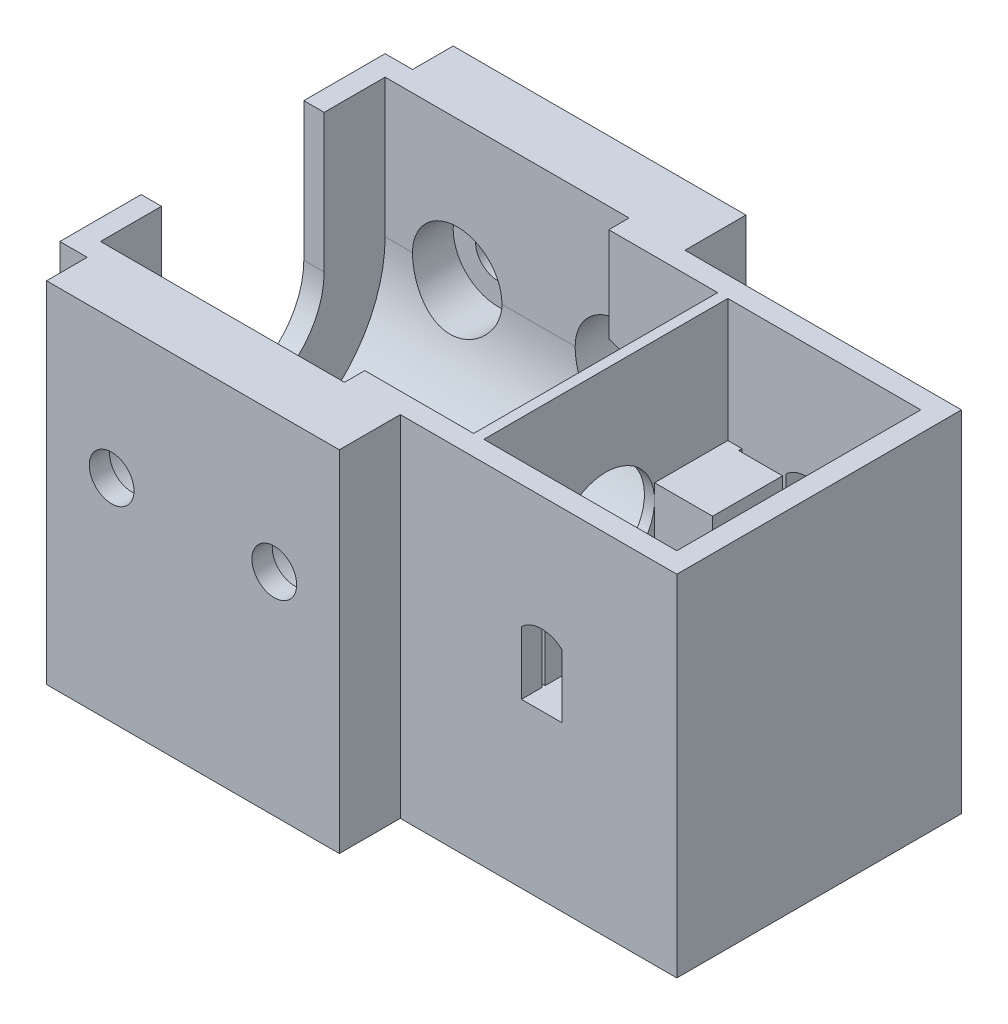
from build123d import *
from build123d.topology import SkipClean

# Parameters (mm, degrees)
SKETCH1_W                       = 116.84
SKETCH1_H                       = 50.8
BOSS_EXTRUDE1_DEPTH             = 31.75
SKETCH38_W                      = 20
SKETCH38_H                      = 20
CUT_EXTRUDE33_DEPTH             = 33.3134
SKETCH37_W                      = 63.5
SKETCH37_H                      = 25.4
CUT_EXTRUDE32_DEPTH             = 132.302277589
BOSS_EXTRUDE5_DEPTH             = 25.4
BOSS_EXTRUDE6_REACH             = 98.929
SKETCH40_W                      = 16.9009
SKETCH40_H                      = 20
SKETCH41_R                      = 3.113413941
CUT_EXTRUDE34_DEPTH             = 97.928543268
CUT_EXTRUDE35_DEPTH             = 97.928543399
CUT_EXTRUDE35_DEPTH_BACK        = 97.928543399
SKETCH42_R                      = 3.4925
SKETCH43_R                      = 6.985
CUT_EXTRUDE36_DEPTH             = 28.575
CUT_EXTRUDE37_START             = 28.575
SKETCH43_2_R                    = 6.985
CUT_EXTRUDE37_DEPTH             = 28.575
SKETCH44_W                      = 15.9125
SKETCH44_H                      = 38.1
CUT_EXTRUDE38_DEPTH             = 35.4
CUT_EXTRUDE39_REACH             = 98.929
SKETCH45_W                      = 14.2259
SKETCH45_H                      = 15.4
CUT_EXTRUDE39_DIRECTION_2_REACH = 98.929
SKETCH46_W                      = 43.18
SKETCH46_H                      = 9.525
SKETCH46_W_2                    = 27.94
SKETCH46_H_2                    = 6.35
CUT_EXTRUDE40_DEPTH             = 97.928543399
SKETCH49_W                      = 23.6641
SKETCH49_H                      = 50.8
CUT_EXTRUDE42_DEPTH             = 97.928543399
SKETCH50_W                      = 0.254
SKETCH50_H                      = 1.524
CUT_EXTRUDE43_DEPTH             = 2.54
SKETCH52_R                      = 0.3175
CUT_EXTRUDE45_DEPTH             = 0.0508
SKETCH53_R                      = 2
CUT_EXTRUDE46_DEPTH             = 0.0254
BOSS_EXTRUDE7_DEPTH             = 2.54
SKETCH55_W                      = 15.9125
SKETCH55_H                      = 9.05
BOSS_EXTRUDE8_DEPTH             = 17.46
CUT_EXTRUDE47_DEPTH             = 7.62
SKETCH58_R                      = 3.113413941
BOSS_EXTRUDE10_DEPTH            = 7.62
SKETCH59_W                      = 0.5
SKETCH59_H                      = 20
CUT_EXTRUDE48_DEPTH             = 7.62
CUT_EXTRUDE44_DEPTH             = 0.635
SKETCH60_W                      = 121.35651469
SKETCH60_H                      = 81.059088534
CUT_EXTRUDE49_DEPTH             = 10.16
SKETCH61_R                      = 8.976217823
SKETCH61_R_2                    = 7.62
BOSS_EXTRUDE11_DEPTH            = 1.5875
BOSS_EXTRUDE12_REACH            = 80.084
SKETCH62_W                      = 1.5875
SKETCH62_H                      = 15.24
SKETCH64_W                      = 30.1384
SKETCH64_H                      = 38.1
BOSS_EXTRUDE14_DEPTH            = 6.35
BOSS_EXTRUDE16_REACH            = 91.468
SKETCH65_W                      = 2.38
SKETCH65_H                      = 9.84
SKETCH66_W                      = 0.5
SKETCH66_H                      = 20
CUT_EXTRUDE50_DEPTH             = 20
CUT_EXTRUDE51_DEPTH             = 9.84
CUT_EXTRUDE53_DEPTH             = 94.560446711


with BuildPart() as part:
    # Sketch1 → Boss-Extrude1 (new, symmetric)
    with BuildSketch(Plane.XY):
        with Locations((-17.78, -25.4)):
            Rectangle(SKETCH1_W, SKETCH1_H)
    extrude(amount=BOSS_EXTRUDE1_DEPTH, both=True)

    # Sketch2 → Cut-Revolve1 (revolve, cut)
    with BuildSketch(Plane.XY, mode=Mode.PRIVATE) as cut_revolve1_sk:
        Polygon((-49.3609, -3.175), (-49.3609, -12.7), (-220.202391615, -12.7), (-220.202391615, -25.4), (-157.809194346, -25.4), (-128.417210056, -25.4), (6.8382, -25.4), (40.64, -25.4), (40.64, -17.78), (23.7391, -17.78), (5.7391, -17.78), (5.7391, -6.35), (-11.2609, -6.35), (-11.2609, -3.175), align=None)
    revolve(cut_revolve1_sk.sketch.rotate(Axis((-152.482877195, -25.4, 0), (1, 0, 0)), 180), axis=Axis((-152.482877195, -25.4, 0), (1, 0, 0)), mode=Mode.SUBTRACT)

    # Sketch38 → Cut-Extrude33 (cut)
    with BuildSketch(Plane(origin=(40.64, 0, 0), x_dir=(0, 0, -1), z_dir=(1, 0, 0))):
        with Locations((0, -25.4)):
            Rectangle(SKETCH38_W, SKETCH38_H)
    extrude(amount=-CUT_EXTRUDE33_DEPTH, mode=Mode.SUBTRACT)

    # Sketch37 → Cut-Extrude32 (cut, through all)
    with BuildSketch(Plane(origin=(40.64, 0, 0), x_dir=(0, 0, -1), z_dir=(1, 0, 0))):
        with Locations((0, -12.7)):
            Rectangle(SKETCH37_W, SKETCH37_H)
    extrude(amount=-CUT_EXTRUDE32_DEPTH, mode=Mode.SUBTRACT)

    # Sketch39 → Boss-Extrude5 (add)
    with BuildSketch(Plane(origin=(0, -25.4, 0), x_dir=(1, 0, 0), z_dir=(0, 1, 0))):
        Polygon((5.7391, 19.05), (5.7391, 7.62), (7.3266, 7.62), (7.3266, 10), (40.64, 10), (40.64, 31.75), (-76.2, 31.75), (-76.2, 12.7), (-49.3609, 12.7), (-49.3609, 22.225), (-11.2609, 22.225), (-11.2609, 19.05), align=None)
        Polygon((40.64, -10), (7.3266, -10), (7.3266, -7.62), (5.7391, -7.62), (5.7391, -19.05), (-11.2609, -19.05), (-11.2609, -22.225), (-49.3609, -22.225), (-49.3609, -12.7), (-76.2, -12.7), (-76.2, -31.75), (40.64, -31.75), align=None)
    extrude(amount=BOSS_EXTRUDE5_DEPTH)

    # Sketch40 → Boss-Extrude6 (add, up to next)
    with BuildSketch(Plane(origin=(0, 0, 0), x_dir=(1, 0, 0), z_dir=(0, 1, 0)), mode=Mode.PRIVATE) as boss_extrude6_sk1:
        with Locations((32.18955, 0)):
            Rectangle(SKETCH40_W, SKETCH40_H)
    boss_extrude6_tool1 = extrude(boss_extrude6_sk1.sketch, amount=-BOSS_EXTRUDE6_REACH, mode=Mode.PRIVATE) - part.part
    add(boss_extrude6_tool1.solids().sort_by_distance((32.18955, 0, 0))[0])

    # Sketch41 → Cut-Extrude34 (cut, through all)
    with BuildSketch(Plane(origin=(0, 0, 0), x_dir=(1, 0, 0), z_dir=(0, 1, 0))):
        with Locations(Location((-57.15, 0, 0), (0, 0, 270))):
            Circle(SKETCH41_R)
        with Locations(Location((-31.75, 0, 0), (0, 0, 270))):
            Circle(SKETCH41_R)
        with Locations(Location((-6.35, 0, 0), (0, 0, 270))):
            Circle(SKETCH41_R)
    extrude(amount=-CUT_EXTRUDE34_DEPTH, mode=Mode.SUBTRACT)

    # Sketch42 → Cut-Extrude35 (cut, two sides: drawn at the far end of the back side and taken through both)
    with BuildSketch(Plane.XY.offset(-CUT_EXTRUDE35_DEPTH_BACK)):
        with Locations((-38.1, -25.4)):
            Circle(SKETCH42_R)
        with Locations((-12.7, -25.4)):
            Circle(SKETCH42_R)
    extrude(amount=CUT_EXTRUDE35_DEPTH + CUT_EXTRUDE35_DEPTH_BACK, mode=Mode.SUBTRACT)

    # Sketch43 → Cut-Extrude36 (cut)
    with BuildSketch(Plane.XY):
        with Locations(Location((-38.1, -25.4, 0), (0, 0, 180))):
            Circle(SKETCH43_R)
        with Locations(Location((-12.7, -25.4, 0), (0, 0, 180))):
            Circle(SKETCH43_R)
    extrude(amount=-CUT_EXTRUDE36_DEPTH, mode=Mode.SUBTRACT)

    # Sketch43<2> → Cut-Extrude37 (cut)
    with BuildSketch(Plane.XY.offset(CUT_EXTRUDE37_START)):
        with Locations(Location((-38.1, -25.4, 0), (0, 0, 180))):
            Circle(SKETCH43_2_R)
        with Locations(Location((-12.7, -25.4, 0), (0, 0, 180))):
            Circle(SKETCH43_2_R)
    extrude(amount=-CUT_EXTRUDE37_DEPTH, mode=Mode.SUBTRACT)

    # Sketch44 → Cut-Extrude38 (cut)
    with BuildSketch(Plane(origin=(0, 0, 0), x_dir=(1, 0, 0), z_dir=(0, 1, 0))):
        with Locations((15.28285, 0)):
            Rectangle(SKETCH44_W, SKETCH44_H)
    extrude(amount=-CUT_EXTRUDE38_DEPTH, mode=Mode.SUBTRACT)

    # Cut-Extrude39: up to this face of the body (flat: up to its plane)
    cut_extrude39_end = Plane(part.part.faces().sort_by_distance((15.28285, -17.7, -19.05))[0])
    # Sketch45 → Cut-Extrude39 (cut, up to the picked face)
    with BuildSketch(Plane.XY, mode=Mode.PRIVATE) as cut_extrude39_sk1:
        with Locations((30.35205, -7.7)):
            Rectangle(SKETCH45_W, SKETCH45_H)
    cut_extrude39_tool1 = split(extrude(cut_extrude39_sk1.sketch, amount=-CUT_EXTRUDE39_REACH, mode=Mode.PRIVATE), bisect_by=cut_extrude39_end, keep=Keep.BOTH, mode=Mode.PRIVATE)
    add(cut_extrude39_tool1.solids().sort_by(Axis((30.35205, -7.7, 0), (0, 0, -1)))[0], mode=Mode.SUBTRACT)

    # Cut-Extrude39 direction 2: up to this face of the body (flat: up to its plane)
    cut_extrude39_direction_2_end = Plane(part.part.faces().sort_by_distance((15.28285, -17.7, 19.05))[0])
    # Sketch45 → Cut-Extrude39 direction 2 (cut, up to the picked face)
    with BuildSketch(Plane.XY, mode=Mode.PRIVATE) as cut_extrude39_direction_2_sk1:
        with Locations((30.35205, -7.7)):
            Rectangle(SKETCH45_W, SKETCH45_H)
    cut_extrude39_direction_2_tool1 = split(extrude(cut_extrude39_direction_2_sk1.sketch, amount=CUT_EXTRUDE39_DIRECTION_2_REACH, mode=Mode.PRIVATE), bisect_by=cut_extrude39_direction_2_end, keep=Keep.BOTH, mode=Mode.PRIVATE)
    add(cut_extrude39_direction_2_tool1.solids().sort_by(Axis((30.35205, -7.7, 0), (0, 0, 1)))[0], mode=Mode.SUBTRACT)

    # Sketch46 → Cut-Extrude40 (cut, through all)
    with BuildSketch(Plane(origin=(0, 0, 0), x_dir=(1, 0, 0), z_dir=(0, 1, 0))):
        with Locations((19.05, 26.9875)):
            Rectangle(SKETCH46_W, SKETCH46_H)
        with Locations((19.05, -26.9875)):
            Rectangle(SKETCH46_W, SKETCH46_H)
        with Locations((-62.23, 28.575)):
            Rectangle(SKETCH46_W_2, SKETCH46_H_2)
        with Locations((-62.23, -28.575)):
            Rectangle(SKETCH46_W_2, SKETCH46_H_2)
    extrude(amount=-CUT_EXTRUDE40_DEPTH, mode=Mode.SUBTRACT)

    # Sketch49 → Cut-Extrude42 (cut, through all)
    with BuildSketch(Plane(origin=(0, 0, 0), x_dir=(1, 0, 0), z_dir=(0, 1, 0))):
        with Locations((-64.36795, 0)):
            Rectangle(SKETCH49_W, SKETCH49_H)
    extrude(amount=-CUT_EXTRUDE42_DEPTH, mode=Mode.SUBTRACT)

    # Sketch50 → Cut-Extrude43 (cut)
    with BuildSketch(Plane(origin=(0, 0, 0), x_dir=(1, 0, 0), z_dir=(0, 1, 0))):
        with Locations((23.1121, 21.463)):
            Rectangle(SKETCH50_W, SKETCH50_H)
        with Locations((21.5881, 21.463)):
            Rectangle(SKETCH50_W, SKETCH50_H)
        with Locations((20.0641, 21.463)):
            Rectangle(SKETCH50_W, SKETCH50_H)
        with Locations((18.5401, 21.463)):
            Rectangle(SKETCH50_W, SKETCH50_H)
        with Locations((17.0161, 21.463)):
            Rectangle(SKETCH50_W, SKETCH50_H)
        with Locations((15.4921, 21.463)):
            Rectangle(SKETCH50_W, SKETCH50_H)
        with Locations((13.9681, 21.463)):
            Rectangle(SKETCH50_W, SKETCH50_H)
        with Locations((12.4441, 21.463)):
            Rectangle(SKETCH50_W, SKETCH50_H)
        with Locations((10.9201, 21.463)):
            Rectangle(SKETCH50_W, SKETCH50_H)
        with Locations((9.3961, 21.463)):
            Rectangle(SKETCH50_W, SKETCH50_H)
    extrude(amount=-CUT_EXTRUDE43_DEPTH, mode=Mode.SUBTRACT)

    # Sketch52 → Cut-Extrude45 (cut)
    with BuildSketch(Plane.ZY.offset(-23.7391)):
        with Locations(Location((0, -25.4, 0), (0, 0, 270))):
            Circle(SKETCH52_R)
    extrude(amount=-CUT_EXTRUDE45_DEPTH, mode=Mode.SUBTRACT)

    # Sketch53 → Cut-Extrude46 (cut)
    with BuildSketch(Plane.ZY.offset(-23.7391)):
        with Locations(Location((0, -25.4, 0), (0, 0, 270))):
            Circle(SKETCH53_R)
    extrude(amount=-CUT_EXTRUDE46_DEPTH, mode=Mode.SUBTRACT)

    # Sketch54 → Boss-Extrude7 (add)
    with BuildSketch(Plane(origin=(0, -35.4, 0), x_dir=(1, 0, 0), z_dir=(0, 1, 0))):
        Polygon((23.2391, 10), (23.2391, -10), (23.2391, -19.05), (7.3266, -19.05), (7.3266, 19.05), (23.2391, 19.05), align=None)
    extrude(amount=BOSS_EXTRUDE7_DEPTH)

    # Sketch55 → Boss-Extrude8 (add)
    with BuildSketch(Plane(origin=(0, -32.86, 0), x_dir=(1, 0, 0), z_dir=(0, 1, 0))):
        with Locations((15.28285, 14.525)):
            Rectangle(SKETCH55_W, SKETCH55_H)
        with Locations((15.28285, -14.525)):
            Rectangle(SKETCH55_W, SKETCH55_H)
    extrude(amount=BOSS_EXTRUDE8_DEPTH)

    # Sketch57 → Cut-Extrude47 (cut)
    with BuildSketch(Plane(origin=(0, -15.4, 0), x_dir=(1, 0, 0), z_dir=(0, 1, 0))):
        Polygon((23.7391, -10), (7.3266, -10), (7.3266, -19.05), (37.465, -19.05), (37.465, 19.05), (7.3266, 19.05), (7.3266, 10), (23.7391, 10), align=None)
    extrude(amount=-CUT_EXTRUDE47_DEPTH, mode=Mode.SUBTRACT)

    # Sketch58 → Boss-Extrude10 (add)
    with SkipClean():  # the faces are left unmerged after this step: merging them gives an invalid solid
        with BuildSketch(Plane.XZ.offset(50.8)):
            Polygon((-48.26, 25.4), (-52.5359, 25.4), (-52.5359, -25.4), (-48.26, -25.4), (-48.26, -31.75), (-2.54, -31.75), (-2.54, -22.225), (40.64, -22.225), (40.64, 22.225), (-2.54, 22.225), (-2.54, 31.75), (-48.26, 31.75), align=None)
            with Locations((-31.75, 0)):
                Circle(SKETCH58_R, mode=Mode.SUBTRACT)
            with Locations(Location((-6.35, 0, 0), (0, 0, 90))):
                Circle(SKETCH58_R, mode=Mode.SUBTRACT)
        extrude(amount=BOSS_EXTRUDE10_DEPTH)

    # Sketch59 → Cut-Extrude48 (cut)
    with SkipClean():  # the faces are left unmerged after this step: merging them gives an invalid solid
        with BuildSketch(Plane(origin=(0, -35.4, 0), x_dir=(1, 0, 0), z_dir=(0, 1, 0))):
            with Locations((23.4891, 0)):
                Rectangle(SKETCH59_W, SKETCH59_H)
        extrude(amount=-CUT_EXTRUDE48_DEPTH, mode=Mode.SUBTRACT)

    # Sketch51 → Cut-Extrude44 (cut)
    # profile 1 of 3: a face of its own
    with SkipClean():  # the faces are left unmerged after this step: merging them gives an invalid solid
        with BuildSketch(Plane(origin=(0, -23.02, 0), x_dir=(1, 0, 0), z_dir=(0, 1, 0))):
            Polygon((25.098, 0.254), (26.10821862, 0.254), (26.10821862, 2.54), (26.61621862, 2.54), (26.61621862, 0.254), (27.62643724, 0.254), (27.62643724, 2.54), (28.13443724, 2.54), (28.13443724, 0.254), (29.14465586, 0.254), (29.14465586, 2.54), (29.65265586, 2.54), (29.65265586, 0.254), (30.66287448, 0.254), (30.66287448, 2.54), (31.17087448, 2.54), (31.17087448, 0.254), (32.1810931, 0.254), (32.1810931, 2.54), (32.6890931, 2.54), (32.6890931, 0.254), (33.69931172, 0.254), (33.69931172, 2.54), (34.20731172, 2.54), (34.20731172, 0.254), (35.21753034, 0.254), (35.21753034, 2.54), (35.72553034, 2.54), (35.72553034, 0.254), (37.465, 0.254), (37.465, -0.254), (35.72553034, -0.254), (35.72553034, -2.54), (35.21753034, -2.54), (35.21753034, -0.254), (34.20731172, -0.254), (34.20731172, -2.54), (33.69931172, -2.54), (33.69931172, -0.254), (32.6890931, -0.254), (32.6890931, -2.54), (32.1810931, -2.54), (32.1810931, -0.254), (31.17087448, -0.254), (31.17087448, -2.54), (30.66287448, -2.54), (30.66287448, -0.254), (29.65265586, -0.254), (29.65265586, -2.54), (29.14465586, -2.54), (29.14465586, -0.254), (28.13443724, -0.254), (28.13443724, -2.54), (27.62643724, -2.54), (27.62643724, -0.254), (26.61621862, -0.254), (26.61621862, -2.54), (26.10821862, -2.54), (26.10821862, -0.254), (25.098, -0.254), (25.098, -2.54), (24.59, -2.54), (24.59, -0.254), (23.7391, -0.254), (23.7391, 0.254), (24.59, 0.254), (24.59, 2.54), (25.098, 2.54), align=None)
        # profile 2 of 3: a face of its own
        with BuildSketch(Plane(origin=(0, -23.02, 0), x_dir=(1, 0, 0), z_dir=(0, 1, 0))):
            Polygon((28.479138622, 15.275362077), (29.450192308, 15.275362077), (29.450192308, 11.775362077), (28.821987179, 11.775362077), (28.821987179, 14.692028743), (28.104038462, 14.692028743), align=None)
        # profile 3 of 3: a face of its own
        with BuildSketch(Plane(origin=(0, -23.02, 0), x_dir=(1, 0, 0), z_dir=(0, 1, 0))):
            with BuildLine():
                add(Edge.make_bspline(
                    [(31.705701122, 15.365105667), (31.736108857, 15.364654255), (31.79589859, 15.36376666), (31.883957611, 15.354153278), (31.968782796, 15.33963014), (32.05070599, 15.319375426), (32.129137502, 15.292569034), (32.204648173, 15.260482242), (32.276339208, 15.221432032), (32.345124896, 15.177322815), (32.41097874, 15.127384927), (32.472317991, 15.070453157), (32.530262832, 15.007837507), (32.583558972, 14.93859134), (32.63338667, 14.863344524), (32.679582199, 14.782085126), (32.721791923, 14.694415438), (32.760488911, 14.600177251), (32.79509188, 14.497957976), (32.824237918, 14.386585113), (32.849235522, 14.26603323), (32.870335264, 14.136002253), (32.886283259, 13.99631934), (32.897032528, 13.847077291), (32.904409186, 13.688563821), (32.905011217, 13.579824883), (32.905320513, 13.523959833)],
                    knots=[0, 0, 0, 0, 0.879237366, 1.728815576, 2.559023295, 3.367336655, 4.166867292, 4.954216142, 5.737608147, 6.525189134, 7.316157332, 8.124696809, 8.942788509, 9.781158001, 10.649253743, 11.551476218, 12.482711956, 13.461909668, 14.496590415, 15.601789533, 16.789733467, 18.056700938, 19.410929216, 20.8549011, 22.384193279, 24, 24, 24, 24], degree=3))
                add(Edge.make_bspline(
                    [(32.905320513, 13.523959833), (32.904986247, 13.467395849), (32.904336776, 13.357493042), (32.897339178, 13.197529727), (32.885288983, 13.047204091), (32.869757823, 12.906531685), (32.848484382, 12.775586796), (32.823570225, 12.654030366), (32.793964125, 12.541906454), (32.758221346, 12.439467702), (32.719758592, 12.345064012), (32.677433406, 12.257565258), (32.631983512, 12.176734446), (32.584451392, 12.101352132), (32.53223116, 12.033640548), (32.477864523, 11.971297148), (32.418984261, 11.91669667), (32.358069459, 11.867025252), (32.292888563, 11.824099179), (32.224113765, 11.786556742), (32.150518931, 11.756105368), (32.073445569, 11.729620389), (31.991579948, 11.710607031), (31.906222902, 11.695520557), (31.816410766, 11.687182846), (31.755263047, 11.686148498), (31.723930288, 11.685618487)],
                    knots=[0, 0, 0, 0, 1.643780988, 3.193836972, 4.651895693, 6.025988579, 7.305620092, 8.505800249, 9.631074763, 10.672816429, 11.65661981, 12.592235626, 13.49536222, 14.350718032, 15.179365177, 15.97804903, 16.751647189, 17.51006938, 18.259804725, 19.016521909, 19.783502495, 20.571750527, 21.382245291, 22.22305063, 23.089471752, 24, 24, 24, 24], degree=3))
                add(Edge.make_bspline(
                    [(31.723930288, 11.685618487), (31.692598376, 11.686158722), (31.631219619, 11.687217034), (31.541164622, 11.695458563), (31.455355227, 11.710668147), (31.372841917, 11.729766359), (31.294198974, 11.756046767), (31.219049305, 11.787409225), (31.147970748, 11.824717415), (31.080766497, 11.867743502), (31.017666007, 11.917082581), (30.957688695, 11.972206915), (30.900967236, 12.032976778), (30.848364504, 12.100072842), (30.799019017, 12.172599516), (30.753445372, 12.251385018), (30.711670956, 12.336314638), (30.672389059, 12.427506761), (30.638258063, 12.526924647), (30.607883061, 12.635456086), (30.583000659, 12.754005777), (30.562988566, 12.882535634), (30.547010922, 13.020773362), (30.535125391, 13.168785683), (30.528088925, 13.326641539), (30.527446264, 13.435143731), (30.527115385, 13.491007109)],
                    knots=[0, 0, 0, 0, 0.917216111, 1.796812873, 2.643793957, 3.46689424, 4.273913431, 5.068098542, 5.848489301, 6.620921603, 7.401012384, 8.190319798, 9.003608147, 9.831726257, 10.68377682, 11.569763213, 12.493818149, 13.453288342, 14.474581811, 15.568529029, 16.750744269, 18.018426408, 19.375425659, 20.823733699, 22.36466933, 24, 24, 24, 24], degree=3))
                add(Edge.make_bspline(
                    [(30.527115385, 13.491007109), (30.527714742, 13.568624874), (30.528871211, 13.718389352), (30.543526831, 13.934755479), (30.565037565, 14.134748483), (30.596631737, 14.318033825), (30.635697494, 14.485290342), (30.68572323, 14.635416233), (30.742673891, 14.770488829), (30.791203171, 14.850506648), (30.814575321, 14.889043968)],
                    knots=[0, 0, 0, 0, 1.288568992, 2.486310467, 3.599230591, 4.627010532, 5.572937695, 6.447898582, 7.252493626, 8, 8, 8, 8], degree=3))
                add(Edge.make_bspline(
                    [(30.814575321, 14.889043968), (30.841751342, 14.926903019), (30.89488582, 15.000924925), (30.98779294, 15.098101851), (31.087609544, 15.181212316), (31.196385808, 15.248375457), (31.312401391, 15.301340315), (31.436652344, 15.338748798), (31.568679831, 15.360544723), (31.659345308, 15.363562649), (31.705701122, 15.365105667)],
                    knots=[0, 0, 0, 0, 1.058512271, 2.069600068, 3.047294572, 4.004278952, 4.967380941, 5.939006123, 6.946246673, 8, 8, 8, 8], degree=3))
            make_face()
            with BuildLine():
                add(Edge.make_bspline(
                    [(31.721125801, 14.736900538), (31.693636956, 14.735597622), (31.639744228, 14.733043214), (31.561543311, 14.711359892), (31.487804729, 14.677868833), (31.43171376, 14.637567579), (31.389730227, 14.598933995), (31.360396031, 14.563971858), (31.332107823, 14.524956632), (31.307122253, 14.480127762), (31.283529353, 14.431096001), (31.260471978, 14.377638775), (31.241570985, 14.318443058), (31.22300126, 14.254516962), (31.206732449, 14.184093099), (31.193102752, 14.106595833), (31.180925815, 14.021521191), (31.172432257, 13.928813449), (31.164513711, 13.828569603), (31.158837323, 13.720566347), (31.156464168, 13.60483282), (31.155709814, 13.525128858), (31.155320513, 13.483995891)],
                    knots=[0, 0, 0, 0, 1.076674018, 2.110852608, 3.161083442, 4.239746716, 4.804137807, 5.395870207, 6.026861976, 6.692161227, 7.405688833, 8.16177676, 8.973626916, 9.841385931, 10.773283133, 11.807421078, 12.927755683, 14.143907515, 15.458935494, 16.872852025, 18.386167141, 20, 20, 20, 20], degree=3))
                add(Edge.make_bspline(
                    [(31.155320513, 13.483995891), (31.155961255, 13.430706144), (31.157189925, 13.328519103), (31.163625124, 13.18157058), (31.176523946, 13.047835592), (31.192567477, 12.926407766), (31.215101272, 12.818074595), (31.241027861, 12.721811147), (31.273044893, 12.638844547), (31.310046743, 12.56797491), (31.351027959, 12.507686258), (31.395514872, 12.456440632), (31.441992862, 12.412064338), (31.491912657, 12.376018021), (31.545155165, 12.348393785), (31.601275908, 12.328524013), (31.66031055, 12.316360899), (31.700736864, 12.314674266), (31.721125801, 12.313823615)],
                    knots=[0, 0, 0, 0, 1.771748488, 3.397459088, 4.888034009, 6.237357457, 7.467047327, 8.564189669, 9.548206622, 10.417051504, 11.216568818, 11.965764335, 12.669334354, 13.348544111, 14.005342236, 14.656555988, 15.322436492, 16, 16, 16, 16], degree=3))
                add(Edge.make_bspline(
                    [(31.721125801, 12.313823615), (31.740815055, 12.314405693), (31.779364165, 12.31554533), (31.8355774, 12.327243546), (31.88873663, 12.346262304), (31.93868135, 12.373165672), (31.985590205, 12.407377421), (32.029233934, 12.449047892), (32.069283384, 12.498592443), (32.092616376, 12.535361826), (32.104639423, 12.554308391)],
                    knots=[0, 0, 0, 0, 0.992283464, 1.942767638, 2.88273346, 3.832339453, 4.79467288, 5.803907806, 6.868395428, 8, 8, 8, 8], degree=3))
                add(Edge.make_bspline(
                    [(32.104639423, 12.554308391), (32.118794536, 12.580198266), (32.14847666, 12.634487234), (32.182824866, 12.726097844), (32.211737271, 12.829419471), (32.236621755, 12.944773662), (32.253641224, 13.072615387), (32.26829837, 13.212133992), (32.275367876, 13.364032035), (32.27651777, 13.469267547), (32.277115385, 13.523959833)],
                    knots=[0, 0, 0, 0, 0.710965849, 1.490837728, 2.352621235, 3.297892224, 4.334225155, 5.461620853, 6.680770821, 8, 8, 8, 8], degree=3))
                add(Edge.make_bspline(
                    [(32.277115385, 13.523959833), (32.276884539, 13.579126875), (32.2764402, 13.685314012), (32.268287873, 13.83775814), (32.256935135, 13.97699055), (32.240329357, 14.102700393), (32.218963004, 14.215192838), (32.192628894, 14.314460531), (32.161582937, 14.400699109), (32.124766133, 14.473822582), (32.083989234, 14.535967502), (32.040703311, 14.589283024), (31.994725333, 14.634802471), (31.946132191, 14.672697141), (31.89379918, 14.701651512), (31.838725927, 14.722095692), (31.780799529, 14.734463736), (31.741285525, 14.736077307), (31.721125801, 14.736900538)],
                    knots=[0, 0, 0, 0, 1.793836731, 3.452829483, 4.963243077, 6.335886805, 7.574563692, 8.684454726, 9.672768357, 10.54971625, 11.340229787, 12.085688095, 12.778991901, 13.440269426, 14.083255152, 14.715733572, 15.344777694, 16, 16, 16, 16], degree=3))
            make_face(mode=Mode.SUBTRACT)
        extrude(amount=-CUT_EXTRUDE44_DEPTH, mode=Mode.SUBTRACT)

    # Sketch60 → Cut-Extrude49 (cut)
    with SkipClean():  # the faces are left unmerged after this step: merging them gives an invalid solid
        with BuildSketch(Plane(origin=(0, 0, 0), x_dir=(1, 0, 0), z_dir=(0, 1, 0))):
            Rectangle(SKETCH60_W, SKETCH60_H)
        extrude(amount=-CUT_EXTRUDE49_DEPTH, mode=Mode.SUBTRACT)

    # Sketch61 → Boss-Extrude11 (add)
    with SkipClean():  # the faces are left unmerged after this step: merging them gives an invalid solid
        with BuildSketch(Plane.ZY.offset(-5.7391)):
            with Locations((0, -25.4)):
                Circle(SKETCH61_R)
            with Locations(Location((0, -25.4, 0), (0, 0, 270))):
                Circle(SKETCH61_R_2, mode=Mode.SUBTRACT)
        extrude(amount=-BOSS_EXTRUDE11_DEPTH)

    # Sketch62 → Boss-Extrude12 (add, up to next)
    with BuildSketch(Plane(origin=(0, -10.16, 0), x_dir=(1, 0, 0), z_dir=(0, 1, 0)), mode=Mode.PRIVATE) as boss_extrude12_sk1:
        with Locations((6.53285, 0)):
            Rectangle(SKETCH62_W, SKETCH62_H)
    boss_extrude12_tool1 = extrude(boss_extrude12_sk1.sketch, amount=-BOSS_EXTRUDE12_REACH, mode=Mode.PRIVATE) - part.part
    add(boss_extrude12_tool1.solids().sort_by_distance((6.53285, -10.16, 0))[0])

    # Sketch64 → Boss-Extrude14 (add)
    with BuildSketch(Plane(origin=(0, -10.16, 0), x_dir=(1, 0, 0), z_dir=(0, 1, 0))):
        Polygon((-11.2609, 19.05), (5.7391, 19.05), (5.7391, -19.05), (-11.2609, -19.05), (-11.2609, -22.225), (-49.3609, -22.225), (-49.3609, -12.7), (-52.5359, -12.7), (-52.5359, -25.4), (-48.26, -25.4), (-48.26, -31.75), (-2.54, -31.75), (-2.54, -22.225), (40.64, -22.225), (40.64, 22.225), (-2.54, 22.225), (-2.54, 31.75), (-48.26, 31.75), (-48.26, 25.4), (-52.5359, 25.4), (-52.5359, 12.7), (-49.3609, 12.7), (-49.3609, 22.225), (-11.2609, 22.225), align=None)
        with Locations((22.3958, 0)):
            Rectangle(SKETCH64_W, SKETCH64_H, mode=Mode.SUBTRACT)
    extrude(amount=BOSS_EXTRUDE14_DEPTH)

    # Sketch65 → Boss-Extrude16 (add, up to next)
    with BuildSketch(Plane(origin=(7.3266, 0, 0), x_dir=(0, 0, -1), z_dir=(1, 0, 0)), mode=Mode.PRIVATE) as boss_extrude16_sk1:
        with Locations((-8.81, -27.94)):
            Rectangle(SKETCH65_W, SKETCH65_H)
    boss_extrude16_tool1 = extrude(boss_extrude16_sk1.sketch, amount=BOSS_EXTRUDE16_REACH, mode=Mode.PRIVATE) - part.part
    # Sketch65 → Boss-Extrude16 (add, up to next)
    with BuildSketch(Plane(origin=(7.3266, 0, 0), x_dir=(0, 0, -1), z_dir=(1, 0, 0)), mode=Mode.PRIVATE) as boss_extrude16_sk2:
        with Locations((8.81, -27.94)):
            Rectangle(SKETCH65_W, SKETCH65_H)
    boss_extrude16_tool2 = extrude(boss_extrude16_sk2.sketch, amount=BOSS_EXTRUDE16_REACH, mode=Mode.PRIVATE) - part.part
    add(boss_extrude16_tool1.solids().sort_by_distance((7.3266, -27.94, 8.81))[0])
    add(boss_extrude16_tool2.solids().sort_by_distance((7.3266, -27.94, -8.81))[0])

    # Sketch66 → Cut-Extrude50 (cut)
    with BuildSketch(Plane(origin=(0, -23.02, 0), x_dir=(1, 0, 0), z_dir=(0, 1, 0))):
        with Locations((23.4891, 0)):
            Rectangle(SKETCH66_W, SKETCH66_H)
    extrude(amount=-CUT_EXTRUDE50_DEPTH, mode=Mode.SUBTRACT)

    # Sketch67 → Cut-Extrude51 (cut)
    with BuildSketch(Plane(origin=(0, -23.02, 0), x_dir=(1, 0, 0), z_dir=(0, 1, 0))):
        Polygon((22.7311, 7.62), (16.3811, 7.62), (16.3811, 18.542), (9.5231, 18.542), (9.5231, 19.05), (29.5891, 19.05), (29.5891, 18.542), (22.7311, 18.542), align=None)
    cut_extrude51 = extrude(amount=-CUT_EXTRUDE51_DEPTH, mode=Mode.SUBTRACT)

    # Sketch69 → Cut-Extrude53 (cut, through all)
    with SkipClean():  # the faces are left unmerged after this step: merging them gives an invalid solid
        with BuildSketch(Plane.XY.offset(-19.05)):
            with BuildLine():
                Line((16.3811, -32.86), (22.7311, -32.86))
                Line((22.7311, -32.86), (22.7311, -23.02))
                ThreePointArc((22.7311, -23.02), (19.5561, -21.75), (16.3811, -23.02))
                Line((16.3811, -23.02), (16.3811, -32.86))
            make_face()
        cut_extrude53 = extrude(amount=-CUT_EXTRUDE53_DEPTH, mode=Mode.SUBTRACT)
    add(part.part.scale(1), mode=Mode.REPLACE)  # the faces are merged on a copy

    # Mirror1: Cut-Extrude51, Cut-Extrude53 across plane
    add(cut_extrude51.mirror(Plane.XY), mode=Mode.SUBTRACT)
    add(cut_extrude53.mirror(Plane.XY), mode=Mode.SUBTRACT)


solid = part.part
